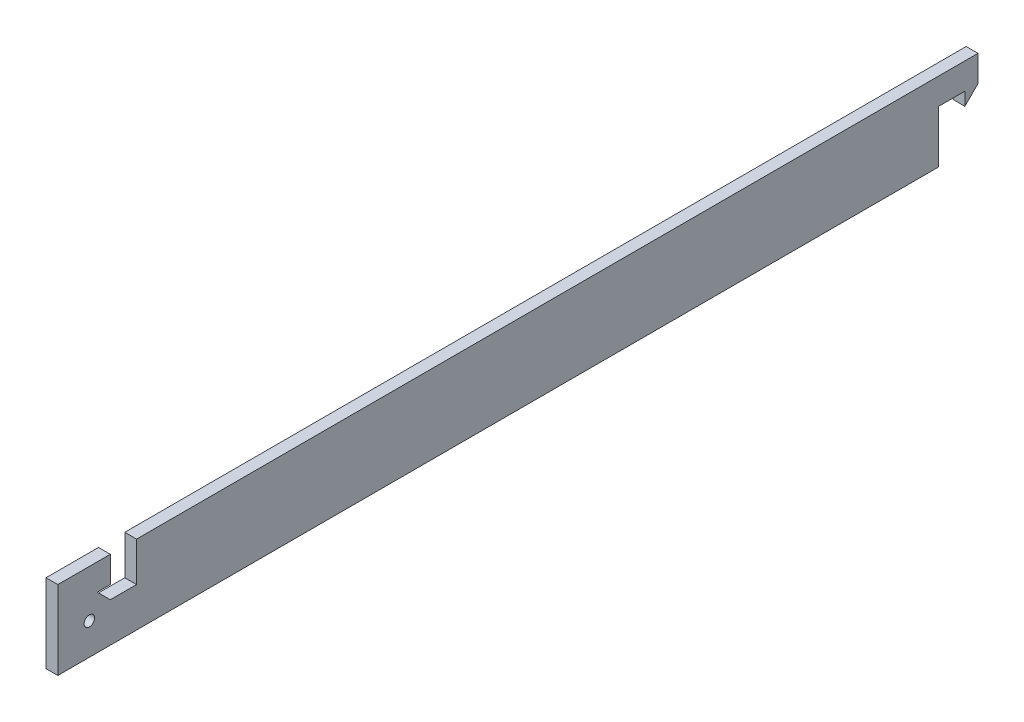
from build123d import *

# Parameters (mm, degrees)
SKETCH1_R           = 2
BOSS_EXTRUDE1_DEPTH = 4.5


with BuildPart() as part:
    # Sketch1 → Boss-Extrude1 (new body)
    with BuildSketch(Plane(origin=(0, 0, 0), x_dir=(0, 0, -1), z_dir=(1, 0, 0))):
        Polygon((-30.84603871, 0), (-40.84603871, 0), (-45.84603871, 5), (-40.84603871, 5), (-40.84603871, 15), (-60.84603871, 15), (-60.84603871, -15), (274.65396129, -15), (274.65396129, 5), (284.65396129, 5), (284.65396129, 0), (289.65396129, 5), (289.65396129, 15), (274.65396129, 15), (-30.84603871, 15), align=None)
        with Locations((-48.84603871, -3)):
            Circle(SKETCH1_R, mode=Mode.SUBTRACT)
    extrude(amount=BOSS_EXTRUDE1_DEPTH)


solid = part.part
